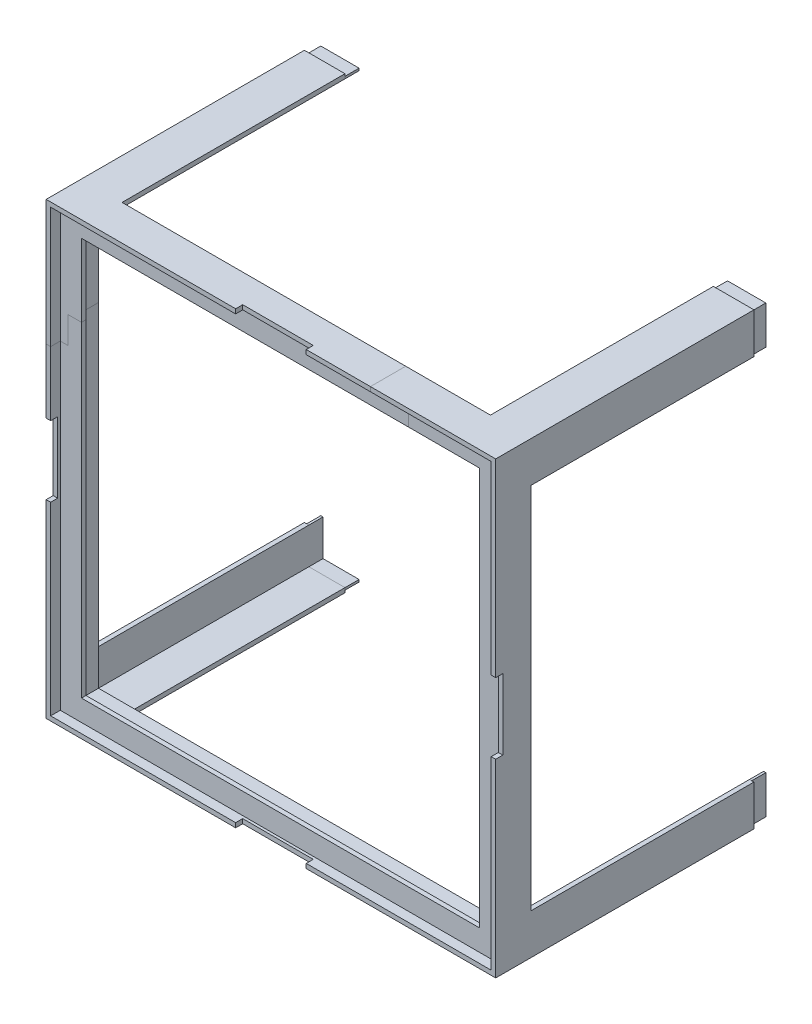
from build123d import *

# Parameters (mm, degrees)
SKETCH1_W                = 260.9625
SKETCH1_H                = 3.175
BOSS_EXTRUDE1_DEPTH      = 10
SKETCH1_W_2              = 3.175
SKETCH1_H_2              = 260.959519773
BOSS_EXTRUDE1_2_DEPTH    = 10
SKETCH1_H_3              = 260.960289546
BOSS_EXTRUDE1_3_DEPTH    = 10
SKETCH1_W_3              = 260.963269773
SKETCH1_H_4              = 3.17875
BOSS_EXTRUDE1_4_DEPTH    = 10
SKETCH1_2_W              = 312.1025
SKETCH1_2_H              = 312.09875
BOSS_EXTRUDE2_DEPTH      = 3.18
BOSS_EXTRUDE4_DEPTH      = 10
BOSS_EXTRUDE4_DEPTH_BACK = 172.932
SKETCH2_W                = 282.1025
SKETCH2_H                = 282.09875
CUT_EXTRUDE1_DEPTH       = 3.18
CUT_EXTRUDE2_START       = -318.4525
SKETCH4_W                = 5
SKETCH4_H                = 50
CUT_EXTRUDE2_DEPTH       = 318.4525
CUT_EXTRUDE3_START       = -318.4525
SKETCH5_W                = 50
SKETCH5_H                = 5
CUT_EXTRUDE3_DEPTH       = 318.4525
SKETCH6_W                = 300.6725
SKETCH6_H                = 3.18
SKETCH6_W_2              = 260.9625
SKETCH6_H_2              = 3.175
BOSS_EXTRUDE5_DEPTH      = 15
CIRPATTERN11_COUNT       = 4
BOSS_EXTRUDE9_DEPTH      = 10
CIRPATTERN16_COUNT       = 4
SPLIT1_START             = -15
SPLIT1_DEPTH             = 18.18
SPLIT1_START_2           = -172.932
SPLIT1_2_DEPTH           = 182.932
SPLIT1_3_DEPTH           = 3.18
SPLIT1_START_3           = 3.18
SPLIT1_4_OUTLINE_W       = 45.48125
SPLIT1_4_OUTLINE_H       = 3.175
SPLIT1_4_OUTLINE_W_2     = 105.48125
SPLIT1_4_OUTLINE_W_3     = 3.175
SPLIT1_4_OUTLINE_H_2     = 60
SPLIT1_4_DEPTH           = 6.82
SPLIT1_START_4           = -182.932
SPLIT1_5_DEPTH           = 10
SPLIT1_6_OUTLINE_W       = 50
SPLIT1_6_OUTLINE_H       = 3.175
SPLIT1_6_DEPTH           = 1.82
SPLIT1_START_5           = -5.55625
SPLIT1_7_DEPTH           = 249.7075
SPLIT1_8_DEPTH           = 229.7075
SPLIT1_9_OUTLINE_W       = 19
SPLIT1_9_OUTLINE_H       = 18.18
SPLIT1_9_DEPTH           = 8.79


# Read off the part's stored shape, not the designer's step: Split1
with BuildPart() as part:
    # Sketch1 → Boss-Extrude1 (new body)
    with BuildSketch(Plane.XY):
        with Locations((153.67, 496.71005)):
            Rectangle(SKETCH1_W, SKETCH1_H)
    extrude(amount=BOSS_EXTRUDE1_DEPTH)



with BuildPart() as body_2:
    # Sketch1 → Boss-Extrude1 2 (new body)
    with BuildSketch(Plane.XY):
        with Locations((-3.96875, 339.072790114)):
            Rectangle(SKETCH1_W_2, SKETCH1_H_2)
    extrude(amount=BOSS_EXTRUDE1_2_DEPTH)


with BuildPart() as body_3:
    # Sketch1 → Boss-Extrude1 3 (new body)
    with BuildSketch(Plane.XY):
        with Locations((311.30875, 339.073175)):
            Rectangle(SKETCH1_W_2, SKETCH1_H_3)
    extrude(amount=BOSS_EXTRUDE1_3_DEPTH)


with BuildPart() as body_4:
    # Sketch1 → Boss-Extrude1 4 (new body)
    with BuildSketch(Plane.XY):
        with Locations((153.669615114, 181.434425)):
            Rectangle(SKETCH1_W_3, SKETCH1_H_4)
    extrude(amount=BOSS_EXTRUDE1_4_DEPTH)


with BuildPart() as part_1:
    add(part.part)

    add(body_2.part)  # Boss-Extrude2 merges body 2

    add(body_3.part)  # Boss-Extrude2 merges body 3

    add(body_4.part)  # Boss-Extrude2 merges body 4
    # Sketch1<2> → Boss-Extrude2 (add)
    with BuildSketch(Plane.XY):
        with Locations((153.67, 339.073175)):
            Rectangle(SKETCH1_2_W, SKETCH1_2_H)
    extrude(amount=BOSS_EXTRUDE2_DEPTH)

    # Sketch1<5> → Boss-Extrude4 (add, two sides: drawn at the far end of the back side and taken through both)
    with BuildSketch(Plane.XY.offset(-BOSS_EXTRUDE4_DEPTH_BACK)):
        Polygon((284.15125, 495.12255), (309.72125, 495.12255), (309.72125, 469.553319773), (312.89625, 469.553319773), (312.89625, 498.29755), (284.15125, 498.29755), align=None)
        Polygon((-2.38125, 495.12255), (23.18875, 495.12255), (23.18875, 498.29755), (-5.55625, 498.29755), (-5.55625, 469.55255), (-2.38125, 469.55255), align=None)
        Polygon((-2.38125, 183.0238), (-2.38125, 208.593030227), (-5.55625, 208.593030227), (-5.55625, 179.84505), (23.187980227, 179.84505), (23.187980227, 183.0238), align=None)
        Polygon((312.89625, 208.593030227), (309.72125, 208.593030227), (309.72125, 183.0238), (284.15125, 183.0238), (284.15125, 179.84505), (312.89625, 179.84505), align=None)
    extrude(amount=BOSS_EXTRUDE4_DEPTH + BOSS_EXTRUDE4_DEPTH_BACK)

    # Sketch2 → Cut-Extrude1 (cut)
    with BuildSketch(Plane.XY.offset(3.18)):
        with Locations((153.67, 339.073175)):
            Rectangle(SKETCH2_W, SKETCH2_H)
    extrude(amount=-CUT_EXTRUDE1_DEPTH, mode=Mode.SUBTRACT)

    # Sketch4 → Cut-Extrude2 (cut)
    with BuildSketch(Plane.ZY.offset(5.55625).offset(CUT_EXTRUDE2_START)):
        with Locations((7.5, 339.0713)):
            Rectangle(SKETCH4_W, SKETCH4_H)
    extrude(amount=CUT_EXTRUDE2_DEPTH, mode=Mode.SUBTRACT)

    # Sketch5 → Cut-Extrude3 (cut)
    with BuildSketch(Plane.XZ.offset(-179.84505).offset(CUT_EXTRUDE3_START)):
        with Locations((153.67, 7.5)):
            Rectangle(SKETCH5_W, SKETCH5_H)
    extrude(amount=CUT_EXTRUDE3_DEPTH, mode=Mode.SUBTRACT)

    # Sketch6 → Boss-Extrude5 (add)
    with BuildSketch(Plane(origin=(0, 0, 0), x_dir=(-1, 0, 0), z_dir=(0, 0, -1))):
        with Locations((-153.67, 487.81755)):
            Rectangle(SKETCH6_W, SKETCH6_H)
        with Locations((-153.67, 496.71005)):
            Rectangle(SKETCH6_W_2, SKETCH6_H_2)
    boss_extrude5 = extrude(amount=BOSS_EXTRUDE5_DEPTH)

    # CirPattern11: Boss-Extrude5 ×4 about axis
    cirpattern11_axis = Axis((153.67, 339.0713, 0), (0, 0, 1))
    for i in range(1, CIRPATTERN11_COUNT):
        add(boss_extrude5.rotate(cirpattern11_axis, i * 360 / CIRPATTERN11_COUNT))

    # Sketch12 → Boss-Extrude9 (add)
    with BuildSketch(Plane(origin=(0, 0, -172.932), x_dir=(-1, 0, 0), z_dir=(0, 0, -1))):
        Polygon((-309.72125, 469.55255), (-311.30875, 469.553319773), (-311.30875, 496.71005), (-284.15125, 496.71005), (-284.15125, 495.12255), (-309.72125, 495.12255), align=None)
    boss_extrude9 = extrude(amount=BOSS_EXTRUDE9_DEPTH)

    # CirPattern16: Boss-Extrude9 ×4 about axis
    cirpattern16_axis = Axis((153.67, 339.0713, 0), (0, 0, 1))
    for i in range(1, CIRPATTERN16_COUNT):
        add(boss_extrude9.rotate(cirpattern16_axis, i * 360 / CIRPATTERN16_COUNT))

    # Split1 7 outline → Split1 7 (cut)
    with BuildSketch(Plane.YZ.offset(SPLIT1_START_5)):
        Polygon((489.40755, 0), (489.40755, 3.18), (495.12255, 3.18), (495.12255, 10), (409.55255, 10), (409.55255, 3.18), (428.55255, 3.18), (428.55255, -15), (469.55255, -15), (469.55255, -182.932), (496.71005, -182.932), (496.71005, -172.932), (498.29755, -172.932), (498.29755, -15), (495.12255, -15), (495.12255, 0), align=None)
    extrude(amount=SPLIT1_7_DEPTH, mode=Mode.SUBTRACT)

    # Split1 8 outline → Split1 8 (cut)
    with BuildSketch(Plane.YZ.offset(SPLIT1_START_5)):
        Polygon((489.40755, 3.18), (489.40755, 0), (495.12255, 0), (495.12255, -15), (498.29755, -15), (498.29755, 10), (495.12255, 10), (495.12255, 3.18), align=None)
    extrude(amount=SPLIT1_8_DEPTH, mode=Mode.SUBTRACT)

    # Split1 9 outline → Split1 9 (cut)
    with BuildSketch(Plane.YZ.offset(SPLIT1_START_5)):
        with Locations((419.05255, -5.91)):
            Rectangle(SPLIT1_9_OUTLINE_W, SPLIT1_9_OUTLINE_H)
    extrude(amount=SPLIT1_9_DEPTH, mode=Mode.SUBTRACT)


with BuildPart() as body_2_2:
    # Split1 outline → Split1 (new body)
    with BuildSketch(Plane.XY.offset(SPLIT1_START)):
        Polygon((6.51375, 486.22755), (244.15125, 486.22755), (244.15125, 489.40755), (3.33375, 489.40755), (3.33375, 428.55255), (6.51375, 428.55255), align=None)
        Polygon((224.15125, 495.12255), (224.15125, 498.29755), (-5.55625, 498.29755), (-5.55625, 409.55255), (-2.38125, 409.55255), (-2.38125, 495.12255), align=None)
    extrude(amount=SPLIT1_DEPTH)

    # Split1 2 outline → Split1 2 (add)
    with BuildSketch(Plane.XY.offset(SPLIT1_START_2)):
        Polygon((-2.38125, 495.12255), (23.18875, 495.12255), (23.18875, 498.29755), (-5.55625, 498.29755), (-5.55625, 469.55255), (-2.38125, 469.55255), align=None)
    extrude(amount=SPLIT1_2_DEPTH)

    # Split1 3 outline → Split1 3 (add)
    with BuildSketch(Plane.XY):
        Polygon((12.61875, 480.12255), (244.15125, 480.12255), (244.15125, 486.22755), (6.51375, 486.22755), (6.51375, 428.55255), (12.61875, 428.55255), align=None)
        Polygon((3.33375, 489.40755), (224.15125, 489.40755), (224.15125, 495.12255), (-2.38125, 495.12255), (-2.38125, 409.55255), (3.23375, 409.55255), (3.23375, 428.55255), (3.33375, 428.55255), align=None)
    extrude(amount=SPLIT1_3_DEPTH)

    # Split1 4 outline → Split1 4 (add)
    with BuildSketch(Plane.XY.offset(SPLIT1_START_3)):
        with Locations((201.410625, 496.71005)):
            Rectangle(SPLIT1_4_OUTLINE_W, SPLIT1_4_OUTLINE_H)
        with Locations((75.929375, 496.71005)):
            Rectangle(SPLIT1_4_OUTLINE_W_2, SPLIT1_4_OUTLINE_H)
        with Locations((-3.96875, 439.55255)):
            Rectangle(SPLIT1_4_OUTLINE_W_3, SPLIT1_4_OUTLINE_H_2)
    extrude(amount=SPLIT1_4_DEPTH)

    # Split1 5 outline → Split1 5 (add)
    with BuildSketch(Plane.XY.offset(SPLIT1_START_4)):
        Polygon((-2.38125, 495.12255), (23.18875, 495.12255), (23.187980227, 496.71005), (-3.96875, 496.71005), (-3.96875, 469.55255), (-2.38125, 469.55255), align=None)
    extrude(amount=SPLIT1_5_DEPTH)

    # Split1 6 outline → Split1 6 (add)
    with BuildSketch(Plane.XY.offset(SPLIT1_START_3)):
        with Locations((153.67, 496.71005)):
            Rectangle(SPLIT1_6_OUTLINE_W, SPLIT1_6_OUTLINE_H)
    extrude(amount=SPLIT1_6_DEPTH)


solid = Compound([part_1.part, body_2_2.part])
